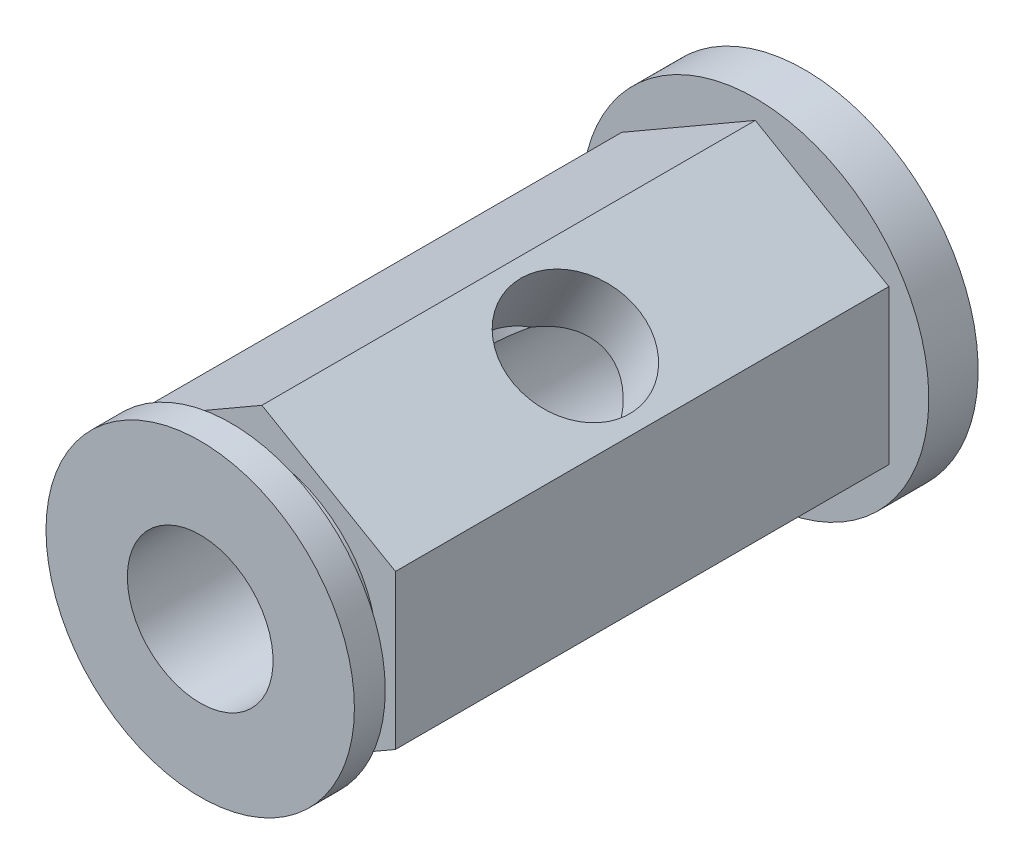
from build123d import *

# Parameters (mm, degrees)
BOSS_EXTRUDE1_DEPTH            = 20.32
SKETCH2_R                      = 7.14375
BOSS_EXTRUDE2_DEPTH            = 2.032
SKETCH3_R                      = 4.738605661
BOSS_EXTRUDE3_DEPTH            = 1.27
SKETCH4_R                      = 6.35
BOSS_EXTRUDE4_DEPTH            = 1.27
SKETCH5_R                      = 3
CUT_EXTRUDE1_DEPTH             = 27.864065071
F_6_0_204_DIAMETER_HOLE1_D     = 5.1816
F_6_0_204_DIAMETER_HOLE1_DEPTH = 3.302
F_6_0_204_DIAMETER_HOLE1_TIP   = 1.556709692


with BuildPart() as part:
    # Sketch1 → Boss-Extrude1 (new body)
    with BuildSketch(Plane.XY):
        Polygon((0, 6.35), (-5.499261314, 3.175), (-5.499261314, -3.175), (0, -6.35), (5.499261314, -3.175), (5.499261314, 3.175), align=None)
    extrude(amount=BOSS_EXTRUDE1_DEPTH)

    # Sketch2 → Boss-Extrude2 (add)
    with BuildSketch(Plane(origin=(0, 0, 0), x_dir=(-1, 0, 0), z_dir=(0, 0, -1))):
        Circle(SKETCH2_R)
    extrude(amount=BOSS_EXTRUDE2_DEPTH)

    # Sketch3 → Boss-Extrude3 (add)
    with BuildSketch(Plane.XY.offset(20.32)):
        Circle(SKETCH3_R)
    extrude(amount=BOSS_EXTRUDE3_DEPTH)

    # Sketch4 → Boss-Extrude4 (add)
    with BuildSketch(Plane.XY.offset(21.59)):
        Circle(SKETCH4_R)
    extrude(amount=BOSS_EXTRUDE4_DEPTH)

    # Sketch5 → Cut-Extrude1 (cut, through all)
    with BuildSketch(Plane(origin=(0, 0, -2.032), x_dir=(-1, 0, 0), z_dir=(0, 0, -1))):
        Circle(SKETCH5_R)
    extrude(amount=-CUT_EXTRUDE1_DEPTH, mode=Mode.SUBTRACT)

    # #6 (0.204) Diameter Hole1
    with Locations(Plane(origin=(2.749630657, 4.7625, 0), x_dir=(0.8660254037844386, -0.4999999999999999, 0), z_dir=(0.49999999999999994, 0.8660254037844387, 0))):
        with Locations((0, -10.16)):
            Hole(F_6_0_204_DIAMETER_HOLE1_D / 2, depth=F_6_0_204_DIAMETER_HOLE1_DEPTH)
            with Locations((0, 0, -(F_6_0_204_DIAMETER_HOLE1_DEPTH + F_6_0_204_DIAMETER_HOLE1_TIP / 2))):  # 118° drill point
                Cone(0, F_6_0_204_DIAMETER_HOLE1_D / 2, F_6_0_204_DIAMETER_HOLE1_TIP, mode=Mode.SUBTRACT)


solid = part.part
